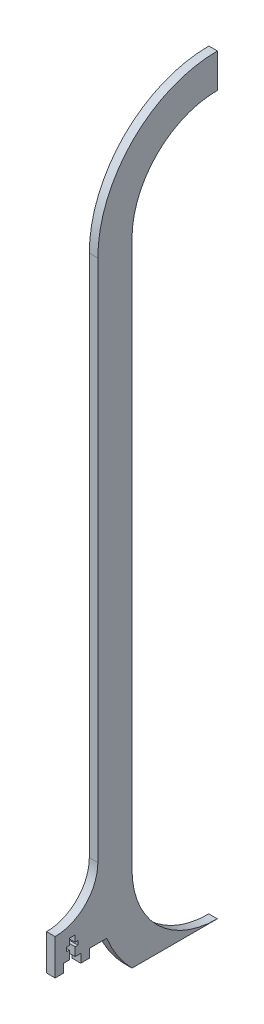
from build123d import *

# Parameters (mm, degrees)
BOSS_EXTRUDE2_DEPTH = 6.35


with BuildPart() as part:
    # Elevator Ball Support Rail → Boss-Extrude2 (new body)
    with BuildSketch(Plane(origin=(0, 0, 0), x_dir=(0, 0, -1), z_dir=(1, 0, 0))):
        with BuildLine():
            Line((63.5, 266.7), (63.5, 292.1))
            ThreePointArc((63.5, 292.1), (0.638207153, 266.061792847), (-25.4, 203.2))
            Line((-25.4, 203.2), (-25.4, -186.055))
            ThreePointArc((-25.4, -186.055), (-34.699359697, -208.505640303), (-57.15, -217.805))
            Line((-57.15, -217.805), (-57.15, -244.475))
            Line((-57.15, -244.475), (-50.8, -244.475))
            Line((-50.8, -244.475), (-50.8, -238.125))
            Line((-50.8, -238.125), (-46.609, -238.125))
            Line((-46.609, -238.125), (-46.609, -231.775))
            Line((-46.609, -231.775), (-48.649999982, -231.775))
            Line((-48.649999982, -231.775), (-48.649999982, -228.874999958))
            Line((-48.649999982, -228.874999958), (-46.609, -228.874999958))
            Line((-46.609, -228.874999958), (-46.609, -224.155))
            Line((-46.609, -224.155), (-42.291, -224.155))
            Line((-42.291, -224.155), (-42.291, -228.874999958))
            Line((-42.291, -228.874999958), (-40.250000018, -228.874999958))
            Line((-40.250000018, -228.874999958), (-40.250000018, -231.775))
            Line((-40.250000018, -231.775), (-42.291, -231.775))
            Line((-42.291, -231.775), (-42.291, -238.125))
            Line((-42.291, -238.125), (-38.1, -238.125))
            Line((-38.1, -238.125), (-38.1, -244.475))
            Line((-38.1, -244.475), (-31.75, -244.475))
            Line((-31.75, -244.475), (-31.75, -238.125))
            Line((-31.75, -238.125), (-18.788657666, -238.125))
            ThreePointArc((-18.788657666, -238.125), (-10.781328961, -253.324481473), (0, -266.7))
            Line((0, -266.7), (63.5, -266.7))
            ThreePointArc((63.5, -266.7), (18.598719395, -248.101280605), (0, -203.2))
            Line((0, -203.2), (0, 203.2))
            ThreePointArc((0, 203.2), (18.598719395, 248.101280605), (63.5, 266.7))
        make_face()
    extrude(amount=BOSS_EXTRUDE2_DEPTH)


solid = part.part
